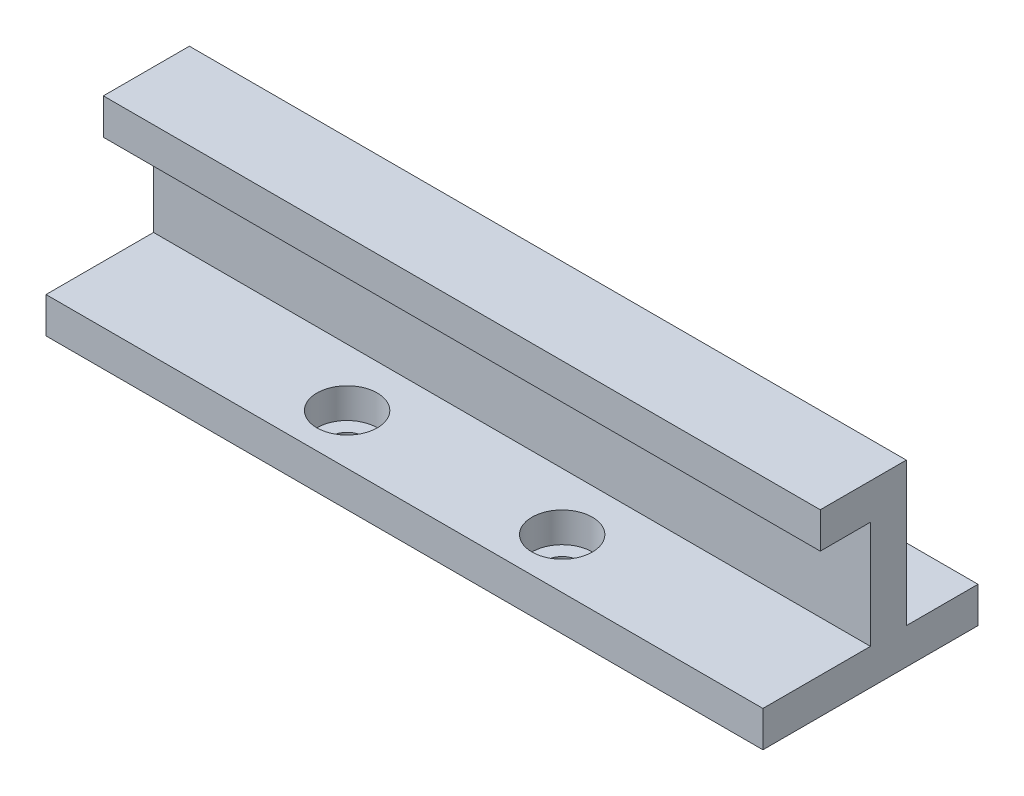
from build123d import *

# Parameters (mm, degrees)
SKETCH1_W                    = 100
SKETCH1_H                    = 20
SKETCH1_R                    = 2.2
EXTRUDE_BASE_DEPTH           = 5
SKETCH2_W                    = 100
SKETCH2_H                    = 5
EXTRUDE_VERTICAL_CLAMP_DEPTH = 20
SKETCH3_W                    = 100
SKETCH3_H                    = 5
EXTRUDE_CLAMP_ROOF_DEPTH     = 7
SKETCH5_W                    = 100
SKETCH5_H                    = 10
SKETCH5_R                    = 2.2
BOSS_EXTRUDE4_DEPTH          = 5
SKETCH4_R                    = 4.215
CUT_EXTRUDE1_DEPTH           = 4.2


with BuildPart() as part:
    # Sketch1 → Extrude-Base (new body)
    with BuildSketch(Plane(origin=(0, 0, 0), x_dir=(1, 0, 0), z_dir=(0, 1, 0))):
        with Locations((50, 10)):
            Rectangle(SKETCH1_W, SKETCH1_H)
        with Locations((35, 7)):
            Circle(SKETCH1_R, mode=Mode.SUBTRACT)
        with Locations((65, 7)):
            Circle(SKETCH1_R, mode=Mode.SUBTRACT)
    extrude(amount=EXTRUDE_BASE_DEPTH)

    # Sketch2 → Extrude-Vertical clamp (add)
    with BuildSketch(Plane(origin=(0, 5, 0), x_dir=(1, 0, 0), z_dir=(0, 1, 0))):
        with Locations((50, 17.5)):
            Rectangle(SKETCH2_W, SKETCH2_H)
    extrude(amount=EXTRUDE_VERTICAL_CLAMP_DEPTH)

    # Sketch3 → Extrude-Clamp Roof (add)
    with BuildSketch(Plane.XY.offset(-15)):
        with Locations((50, 22.5)):
            Rectangle(SKETCH3_W, SKETCH3_H)
    extrude(amount=EXTRUDE_CLAMP_ROOF_DEPTH)

    # Sketch5 → Boss-Extrude4 (add)
    with BuildSketch(Plane(origin=(0, 0, 0), x_dir=(1, 0, 0), z_dir=(0, 1, 0))):
        with Locations((50, 25)):
            Rectangle(SKETCH5_W, SKETCH5_H)
        with Locations((70, 25)):
            Circle(SKETCH5_R, mode=Mode.SUBTRACT)
        with Locations((30, 25)):
            Circle(SKETCH5_R, mode=Mode.SUBTRACT)
    extrude(amount=BOSS_EXTRUDE4_DEPTH)

    # Sketch4 → Cut-Extrude1 (cut)
    with BuildSketch(Plane(origin=(0, 5, 0), x_dir=(1, 0, 0), z_dir=(0, 1, 0))):
        with Locations((35, 7)):
            Circle(SKETCH4_R)
        with Locations((65, 7)):
            Circle(SKETCH4_R)
        with Locations((30, 25)):
            Circle(SKETCH4_R)
        with Locations((70, 25)):
            Circle(SKETCH4_R)
    extrude(amount=-CUT_EXTRUDE1_DEPTH, mode=Mode.SUBTRACT)


solid = part.part
